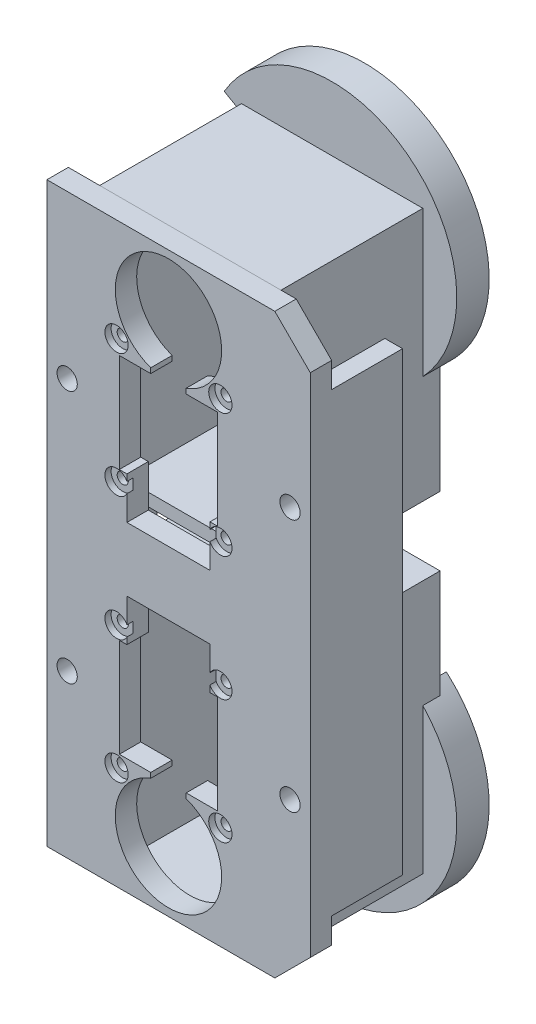
from build123d import *

# Parameters (mm, degrees)
BOSS_1_DEPTH    = 4.225
S_BOX2_W        = 3.5
S_BOX2_H        = 90
BOSS_2_DEPTH    = 14.5
S_BOX3_W        = 3.5
S_BOX3_H        = 90
BOSS_3_DEPTH    = 14.5
S_BOX4_W        = 35.8
S_BOX4_H        = 2.5
BOSS_4_DEPTH    = 35.725
S_BOX5_W        = 35.8
S_BOX5_H        = 1.2
BOSS_5_DEPTH    = 35.725
S_BOX6_W        = 5
S_BOX6_H        = 50.1
BOSS_6_DEPTH    = 35.725
S_BOX7_W        = 5
S_BOX7_H        = 50.1
BOSS_7_DEPTH    = 35.725
S_BOX8_W        = 35.8
S_BOX8_H        = 50.1
BOSS_8_DEPTH    = 4.225
S_CYL9_R        = 19
BOSS_9_DEPTH    = 2.6
BOSS_10_DEPTH   = 6.4
S_BOX11_W       = 35.8
S_BOX11_H       = 1.2
BOSS_11_DEPTH   = 35.725
S_BOX12_W       = 35.8
S_BOX12_H       = 2.5
BOSS_12_DEPTH   = 35.725
S_BOX13_W       = 5
S_BOX13_H       = 50.1
BOSS_13_DEPTH   = 35.725
S_BOX14_W       = 5
S_BOX14_H       = 50.1
BOSS_14_DEPTH   = 35.725
S_BOX15_W       = 35.8
S_BOX15_H       = 50.1
BOSS_15_DEPTH   = 4.225
S_CYL16_R       = 19
BOSS_16_DEPTH   = 2.6
BOSS_17_DEPTH   = 6.4
S_HOLE18_R      = 10.5
HOLE_18_DEPTH   = 4.425
S_CUT19_W       = 19.4
S_CUT19_H       = 19.5
POCKET_19_DEPTH = 4.375
S_CUT20_W       = 16.4
S_CUT20_H       = 8.3
POCKET_20_DEPTH = 4.375
S_CUT21_W       = 7
S_CUT21_H       = 11
POCKET_21_DEPTH = 4.375
S_HOLE22_R      = 1.1
HOLE_22_DEPTH   = 4.425
S_HOLE23_R      = 2.3
HOLE_23_DEPTH   = 1.325
S_HOLE24_R      = 1.1
HOLE_24_DEPTH   = 4.425
S_HOLE25_R      = 2.3
HOLE_25_DEPTH   = 1.325
S_HOLE26_R      = 1.1
HOLE_26_DEPTH   = 4.425
S_HOLE27_R      = 2.3
HOLE_27_DEPTH   = 1.325
S_HOLE28_R      = 1.1
HOLE_28_DEPTH   = 4.425
S_HOLE29_R      = 2.3
HOLE_29_DEPTH   = 1.325
S_CUT30_W       = 25.8
S_CUT30_H       = 46.4
POCKET_30_DEPTH = 6.65
S_HOLE31_R      = 11.5
HOLE_31_DEPTH   = 3.2
S_HOLE32_R      = 0.9
HOLE_32_DEPTH   = 5.7
S_HOLE33_R      = 0.9
HOLE_33_DEPTH   = 5.7
S_HOLE34_R      = 0.9
HOLE_34_DEPTH   = 5.7
S_HOLE35_R      = 0.9
HOLE_35_DEPTH   = 5.7
S_HOLE36_R      = 10.5
HOLE_36_DEPTH   = 4.425
S_CUT37_W       = 19.4
S_CUT37_H       = 19.5
POCKET_37_DEPTH = 4.375
S_CUT38_W       = 16.4
S_CUT38_H       = 8.3
POCKET_38_DEPTH = 4.375
S_CUT39_W       = 7
S_CUT39_H       = 11
POCKET_39_DEPTH = 4.375
S_HOLE40_R      = 1.1
HOLE_40_DEPTH   = 4.425
S_HOLE41_R      = 2.3
HOLE_41_DEPTH   = 1.325
S_HOLE42_R      = 1.1
HOLE_42_DEPTH   = 4.425
S_HOLE43_R      = 2.3
HOLE_43_DEPTH   = 1.325
S_HOLE44_R      = 1.1
HOLE_44_DEPTH   = 4.425
S_HOLE45_R      = 2.3
HOLE_45_DEPTH   = 1.325
S_HOLE46_R      = 1.1
HOLE_46_DEPTH   = 4.425
S_HOLE47_R      = 2.3
HOLE_47_DEPTH   = 1.325
S_CUT48_W       = 25.8
S_CUT48_H       = 46.4
POCKET_48_DEPTH = 6.65
S_HOLE49_R      = 11.5
HOLE_49_DEPTH   = 3.2
S_HOLE50_R      = 0.9
HOLE_50_DEPTH   = 5.7
S_HOLE51_R      = 0.9
HOLE_51_DEPTH   = 5.7
S_HOLE52_R      = 0.9
HOLE_52_DEPTH   = 5.7
S_HOLE53_R      = 0.9
HOLE_53_DEPTH   = 5.7
S_HOLE54_R      = 2
HOLE_54_DEPTH   = 4.425
S_HOLE55_R      = 1.7
HOLE_55_DEPTH   = 4.1
S_HOLE56_R      = 2
HOLE_56_DEPTH   = 4.425
S_HOLE57_R      = 1.7
HOLE_57_DEPTH   = 4.1
S_HOLE58_R      = 2
HOLE_58_DEPTH   = 4.425
S_HOLE59_R      = 1.7
HOLE_59_DEPTH   = 4.1
S_HOLE60_R      = 2
HOLE_60_DEPTH   = 4.425
S_HOLE61_R      = 1.7
HOLE_61_DEPTH   = 4.1


with BuildPart() as part:
    # S_prism1 → Boss_1 (new body)
    with BuildSketch(Plane.XY.offset(64.7)):
        Polygon((28, -50), (28, 50), (21, 57), (-24, 57), (-24, -57), (21, -57), align=None)
    extrude(amount=BOSS_1_DEPTH)

    # S_box2 → Boss_2 (add)
    with BuildSketch(Plane.XY.offset(50.7)):
        with Locations((26.25, 0)):
            Rectangle(S_BOX2_W, S_BOX2_H)
    extrude(amount=BOSS_2_DEPTH)

    # S_box3 → Boss_3 (add)
    with BuildSketch(Plane.XY.offset(50.7)):
        with Locations((-22.25, 0)):
            Rectangle(S_BOX3_W, S_BOX3_H)
    extrude(amount=BOSS_3_DEPTH)

    # S_box4 → Boss_4 (add)
    with BuildSketch(Plane.XY.offset(33.2)):
        with Locations((0, 8.05)):
            Rectangle(S_BOX4_W, S_BOX4_H)
    extrude(amount=BOSS_4_DEPTH)

    # S_box5 → Boss_5 (add)
    with BuildSketch(Plane.XY.offset(33.2)):
        with Locations((0, 56.3)):
            Rectangle(S_BOX5_W, S_BOX5_H)
    extrude(amount=BOSS_5_DEPTH)

    # S_box6 → Boss_6 (add)
    with BuildSketch(Plane.XY.offset(33.2)):
        with Locations((-15.4, 31.85)):
            Rectangle(S_BOX6_W, S_BOX6_H)
    extrude(amount=BOSS_6_DEPTH)

    # S_box7 → Boss_7 (add)
    with BuildSketch(Plane.XY.offset(33.2)):
        with Locations((15.4, 31.85)):
            Rectangle(S_BOX7_W, S_BOX7_H)
    extrude(amount=BOSS_7_DEPTH)

    # S_box8 → Boss_8 (add)
    with BuildSketch(Plane.XY.offset(64.7)):
        with Locations((0, 31.85)):
            Rectangle(S_BOX8_W, S_BOX8_H)
    extrude(amount=BOSS_8_DEPTH)



with BuildPart() as body_2:
    # S_cyl9 → Boss_9 (new body)
    with BuildSketch(Plane.XY.offset(30.1)):
        with Locations((0, 45)):
            Circle(S_CYL9_R)
    extrude(amount=BOSS_9_DEPTH)


with BuildPart() as part_1:
    add(part.part)

    add(body_2.part)  # Boss_10 merges body 2
    # S_prism10 → Boss_10 (add)
    with BuildSketch(Plane.XY.offset(30.2)):
        with BuildLine():
            Line((-21.304224933, 57.3), (-9.526279442, 50.5))
            ThreePointArc((-9.526279442, 50.5), (6.996860423, 53.487870417), (7.216649319, 36.698194618))
            Line((7.216649319, 36.698194618), (16.139052113, 26.434144327))
            ThreePointArc((16.139052113, 26.434144327), (15.647524219, 63.981964751), (-21.304224933, 57.3))
        make_face()
    extrude(amount=BOSS_10_DEPTH)

    # S_box11 → Boss_11 (add)
    with BuildSketch(Plane.XY.offset(33.2)):
        with Locations((0, -56.3)):
            Rectangle(S_BOX11_W, S_BOX11_H)
    extrude(amount=BOSS_11_DEPTH)

    # S_box12 → Boss_12 (add)
    with BuildSketch(Plane.XY.offset(33.2)):
        with Locations((0, -8.05)):
            Rectangle(S_BOX12_W, S_BOX12_H)
    extrude(amount=BOSS_12_DEPTH)

    # S_box13 → Boss_13 (add)
    with BuildSketch(Plane.XY.offset(33.2)):
        with Locations((-15.4, -31.85)):
            Rectangle(S_BOX13_W, S_BOX13_H)
    extrude(amount=BOSS_13_DEPTH)

    # S_box14 → Boss_14 (add)
    with BuildSketch(Plane.XY.offset(33.2)):
        with Locations((15.4, -31.85)):
            Rectangle(S_BOX14_W, S_BOX14_H)
    extrude(amount=BOSS_14_DEPTH)

    # S_box15 → Boss_15 (add)
    with BuildSketch(Plane.XY.offset(64.7)):
        with Locations((0, -31.85)):
            Rectangle(S_BOX15_W, S_BOX15_H)
    extrude(amount=BOSS_15_DEPTH)



with BuildPart() as body_2_2:
    # S_cyl16 → Boss_16 (new body)
    with BuildSketch(Plane.XY.offset(30.1)):
        with Locations((0, -45)):
            Circle(S_CYL16_R)
    extrude(amount=BOSS_16_DEPTH)


with BuildPart() as part_2:
    add(part_1.part)

    add(body_2_2.part)  # Boss_17 merges body 2 2
    # S_prism17 → Boss_17 (add)
    with BuildSketch(Plane.XY.offset(30.2)):
        with BuildLine():
            Line((16.139052113, -26.434144327), (7.216649319, -36.698194618))
            ThreePointArc((7.216649319, -36.698194618), (6.996860423, -53.487870417), (-9.526279442, -50.5))
            Line((-9.526279442, -50.5), (-21.304224933, -57.3))
            ThreePointArc((-21.304224933, -57.3), (15.647524219, -63.981964751), (16.139052113, -26.434144327))
        make_face()
    extrude(amount=BOSS_17_DEPTH)

    # S_hole18 → Hole_18 (cut)
    with BuildSketch(Plane.XY.offset(64.6)):
        with Locations((0, 45)):
            Circle(S_HOLE18_R)
    extrude(amount=HOLE_18_DEPTH, mode=Mode.SUBTRACT)

    # S_cut19 → Pocket_19 (cut)
    with BuildSketch(Plane.XY.offset(64.65)):
        with Locations((0, 24.35)):
            Rectangle(S_CUT19_W, S_CUT19_H)
    extrude(amount=POCKET_19_DEPTH, mode=Mode.SUBTRACT)

    # S_cut20 → Pocket_20 (cut)
    with BuildSketch(Plane.XY.offset(64.65)):
        with Locations((0, 10.45)):
            Rectangle(S_CUT20_W, S_CUT20_H)
    extrude(amount=POCKET_20_DEPTH, mode=Mode.SUBTRACT)

    # S_cut21 → Pocket_21 (cut)
    with BuildSketch(Plane.XY.offset(64.65)):
        with Locations((0, 39.5)):
            Rectangle(S_CUT21_W, S_CUT21_H)
    extrude(amount=POCKET_21_DEPTH, mode=Mode.SUBTRACT)

    # S_hole22 → Hole_22 (cut)
    with BuildSketch(Plane.XY.offset(64.6)):
        with Locations((-10.25, 36.7)):
            Circle(S_HOLE22_R)
    extrude(amount=HOLE_22_DEPTH, mode=Mode.SUBTRACT)

    # S_hole23 → Hole_23 (cut)
    with BuildSketch(Plane.XY.offset(67.7)):
        with Locations((-10.25, 36.7)):
            Circle(S_HOLE23_R)
    extrude(amount=HOLE_23_DEPTH, mode=Mode.SUBTRACT)

    # S_hole24 → Hole_24 (cut)
    with BuildSketch(Plane.XY.offset(64.6)):
        with Locations((10.25, 36.7)):
            Circle(S_HOLE24_R)
    extrude(amount=HOLE_24_DEPTH, mode=Mode.SUBTRACT)

    # S_hole25 → Hole_25 (cut)
    with BuildSketch(Plane.XY.offset(67.7)):
        with Locations((10.25, 36.7)):
            Circle(S_HOLE25_R)
    extrude(amount=HOLE_25_DEPTH, mode=Mode.SUBTRACT)

    # S_hole26 → Hole_26 (cut)
    with BuildSketch(Plane.XY.offset(64.6)):
        with Locations((-10.25, 12.25)):
            Circle(S_HOLE26_R)
    extrude(amount=HOLE_26_DEPTH, mode=Mode.SUBTRACT)

    # S_hole27 → Hole_27 (cut)
    with BuildSketch(Plane.XY.offset(67.7)):
        with Locations((-10.25, 12.25)):
            Circle(S_HOLE27_R)
    extrude(amount=HOLE_27_DEPTH, mode=Mode.SUBTRACT)

    # S_hole28 → Hole_28 (cut)
    with BuildSketch(Plane.XY.offset(64.6)):
        with Locations((10.25, 12.25)):
            Circle(S_HOLE28_R)
    extrude(amount=HOLE_28_DEPTH, mode=Mode.SUBTRACT)

    # S_hole29 → Hole_29 (cut)
    with BuildSketch(Plane.XY.offset(67.7)):
        with Locations((10.25, 12.25)):
            Circle(S_HOLE29_R)
    extrude(amount=HOLE_29_DEPTH, mode=Mode.SUBTRACT)

    # S_cut30 → Pocket_30 (cut)
    with BuildSketch(Plane.XY.offset(30.05)):
        with Locations((0, 32.5)):
            Rectangle(S_CUT30_W, S_CUT30_H)
    extrude(amount=POCKET_30_DEPTH, mode=Mode.SUBTRACT)

    # S_hole31 → Hole_31 (cut)
    with BuildSketch(Plane.XY.offset(30.1)):
        with Locations((0, 45)):
            Circle(S_HOLE31_R)
    extrude(amount=HOLE_31_DEPTH, mode=Mode.SUBTRACT)

    # S_hole32 → Hole_32 (cut)
    with BuildSketch(Plane.XY.offset(30.1)):
        with Locations((19.938771315, 35.702398242)):
            Circle(S_HOLE32_R)
    extrude(amount=HOLE_32_DEPTH, mode=Mode.SUBTRACT)

    # S_hole33 → Hole_33 (cut)
    with BuildSketch(Plane.XY.offset(30.1)):
        with Locations((21.250368178, 50.694018992)):
            Circle(S_HOLE33_R)
    extrude(amount=HOLE_33_DEPTH, mode=Mode.SUBTRACT)

    # S_hole34 → Hole_34 (cut)
    with BuildSketch(Plane.XY.offset(30.1)):
        with Locations((12.6186816, 63.021344974)):
            Circle(S_HOLE34_R)
    extrude(amount=HOLE_34_DEPTH, mode=Mode.SUBTRACT)

    # S_hole35 → Hole_35 (cut)
    with BuildSketch(Plane.XY.offset(30.1)):
        with Locations((0.767788927, 66.986598194)):
            Circle(S_HOLE35_R)
    extrude(amount=HOLE_35_DEPTH, mode=Mode.SUBTRACT)

    # S_hole36 → Hole_36 (cut)
    with BuildSketch(Plane.XY.offset(64.6)):
        with Locations((0, -45)):
            Circle(S_HOLE36_R)
    extrude(amount=HOLE_36_DEPTH, mode=Mode.SUBTRACT)

    # S_cut37 → Pocket_37 (cut)
    with BuildSketch(Plane.XY.offset(64.65)):
        with Locations((0, -24.35)):
            Rectangle(S_CUT37_W, S_CUT37_H)
    extrude(amount=POCKET_37_DEPTH, mode=Mode.SUBTRACT)

    # S_cut38 → Pocket_38 (cut)
    with BuildSketch(Plane.XY.offset(64.65)):
        with Locations((0, -10.45)):
            Rectangle(S_CUT38_W, S_CUT38_H)
    extrude(amount=POCKET_38_DEPTH, mode=Mode.SUBTRACT)

    # S_cut39 → Pocket_39 (cut)
    with BuildSketch(Plane.XY.offset(64.65)):
        with Locations((0, -39.5)):
            Rectangle(S_CUT39_W, S_CUT39_H)
    extrude(amount=POCKET_39_DEPTH, mode=Mode.SUBTRACT)

    # S_hole40 → Hole_40 (cut)
    with BuildSketch(Plane.XY.offset(64.6)):
        with Locations((-10.25, -36.7)):
            Circle(S_HOLE40_R)
    extrude(amount=HOLE_40_DEPTH, mode=Mode.SUBTRACT)

    # S_hole41 → Hole_41 (cut)
    with BuildSketch(Plane.XY.offset(67.7)):
        with Locations((-10.25, -36.7)):
            Circle(S_HOLE41_R)
    extrude(amount=HOLE_41_DEPTH, mode=Mode.SUBTRACT)

    # S_hole42 → Hole_42 (cut)
    with BuildSketch(Plane.XY.offset(64.6)):
        with Locations((10.25, -36.7)):
            Circle(S_HOLE42_R)
    extrude(amount=HOLE_42_DEPTH, mode=Mode.SUBTRACT)

    # S_hole43 → Hole_43 (cut)
    with BuildSketch(Plane.XY.offset(67.7)):
        with Locations((10.25, -36.7)):
            Circle(S_HOLE43_R)
    extrude(amount=HOLE_43_DEPTH, mode=Mode.SUBTRACT)

    # S_hole44 → Hole_44 (cut)
    with BuildSketch(Plane.XY.offset(64.6)):
        with Locations((-10.25, -12.25)):
            Circle(S_HOLE44_R)
    extrude(amount=HOLE_44_DEPTH, mode=Mode.SUBTRACT)

    # S_hole45 → Hole_45 (cut)
    with BuildSketch(Plane.XY.offset(67.7)):
        with Locations((-10.25, -12.25)):
            Circle(S_HOLE45_R)
    extrude(amount=HOLE_45_DEPTH, mode=Mode.SUBTRACT)

    # S_hole46 → Hole_46 (cut)
    with BuildSketch(Plane.XY.offset(64.6)):
        with Locations((10.25, -12.25)):
            Circle(S_HOLE46_R)
    extrude(amount=HOLE_46_DEPTH, mode=Mode.SUBTRACT)

    # S_hole47 → Hole_47 (cut)
    with BuildSketch(Plane.XY.offset(67.7)):
        with Locations((10.25, -12.25)):
            Circle(S_HOLE47_R)
    extrude(amount=HOLE_47_DEPTH, mode=Mode.SUBTRACT)

    # S_cut48 → Pocket_48 (cut)
    with BuildSketch(Plane.XY.offset(30.05)):
        with Locations((0, -32.5)):
            Rectangle(S_CUT48_W, S_CUT48_H)
    extrude(amount=POCKET_48_DEPTH, mode=Mode.SUBTRACT)

    # S_hole49 → Hole_49 (cut)
    with BuildSketch(Plane.XY.offset(30.1)):
        with Locations((0, -45)):
            Circle(S_HOLE49_R)
    extrude(amount=HOLE_49_DEPTH, mode=Mode.SUBTRACT)

    # S_hole50 → Hole_50 (cut)
    with BuildSketch(Plane.XY.offset(30.1)):
        with Locations((19.938771315, -35.702398242)):
            Circle(S_HOLE50_R)
    extrude(amount=HOLE_50_DEPTH, mode=Mode.SUBTRACT)

    # S_hole51 → Hole_51 (cut)
    with BuildSketch(Plane.XY.offset(30.1)):
        with Locations((21.250368178, -50.694018992)):
            Circle(S_HOLE51_R)
    extrude(amount=HOLE_51_DEPTH, mode=Mode.SUBTRACT)

    # S_hole52 → Hole_52 (cut)
    with BuildSketch(Plane.XY.offset(30.1)):
        with Locations((12.6186816, -63.021344974)):
            Circle(S_HOLE52_R)
    extrude(amount=HOLE_52_DEPTH, mode=Mode.SUBTRACT)

    # S_hole53 → Hole_53 (cut)
    with BuildSketch(Plane.XY.offset(30.1)):
        with Locations((0.767788927, -66.986598194)):
            Circle(S_HOLE53_R)
    extrude(amount=HOLE_53_DEPTH, mode=Mode.SUBTRACT)

    # S_hole54 → Hole_54 (cut)
    with BuildSketch(Plane.XY.offset(64.6)):
        with Locations((-20, -25)):
            Circle(S_HOLE54_R)
    extrude(amount=HOLE_54_DEPTH, mode=Mode.SUBTRACT)

    # S_hole55 → Hole_55 (cut)
    with BuildSketch(Plane.XY.offset(60.7)):
        with Locations((-20, -25)):
            Circle(S_HOLE55_R)
    extrude(amount=HOLE_55_DEPTH, mode=Mode.SUBTRACT)

    # S_hole56 → Hole_56 (cut)
    with BuildSketch(Plane.XY.offset(64.6)):
        with Locations((-20, 25)):
            Circle(S_HOLE56_R)
    extrude(amount=HOLE_56_DEPTH, mode=Mode.SUBTRACT)

    # S_hole57 → Hole_57 (cut)
    with BuildSketch(Plane.XY.offset(60.7)):
        with Locations((-20, 25)):
            Circle(S_HOLE57_R)
    extrude(amount=HOLE_57_DEPTH, mode=Mode.SUBTRACT)

    # S_hole58 → Hole_58 (cut)
    with BuildSketch(Plane.XY.offset(64.6)):
        with Locations((24, -25)):
            Circle(S_HOLE58_R)
    extrude(amount=HOLE_58_DEPTH, mode=Mode.SUBTRACT)

    # S_hole59 → Hole_59 (cut)
    with BuildSketch(Plane.XY.offset(60.7)):
        with Locations((24, -25)):
            Circle(S_HOLE59_R)
    extrude(amount=HOLE_59_DEPTH, mode=Mode.SUBTRACT)

    # S_hole60 → Hole_60 (cut)
    with BuildSketch(Plane.XY.offset(64.6)):
        with Locations((24, 25)):
            Circle(S_HOLE60_R)
    extrude(amount=HOLE_60_DEPTH, mode=Mode.SUBTRACT)

    # S_hole61 → Hole_61 (cut)
    with BuildSketch(Plane.XY.offset(60.7)):
        with Locations((24, 25)):
            Circle(S_HOLE61_R)
    extrude(amount=HOLE_61_DEPTH, mode=Mode.SUBTRACT)


solid = part_2.part
